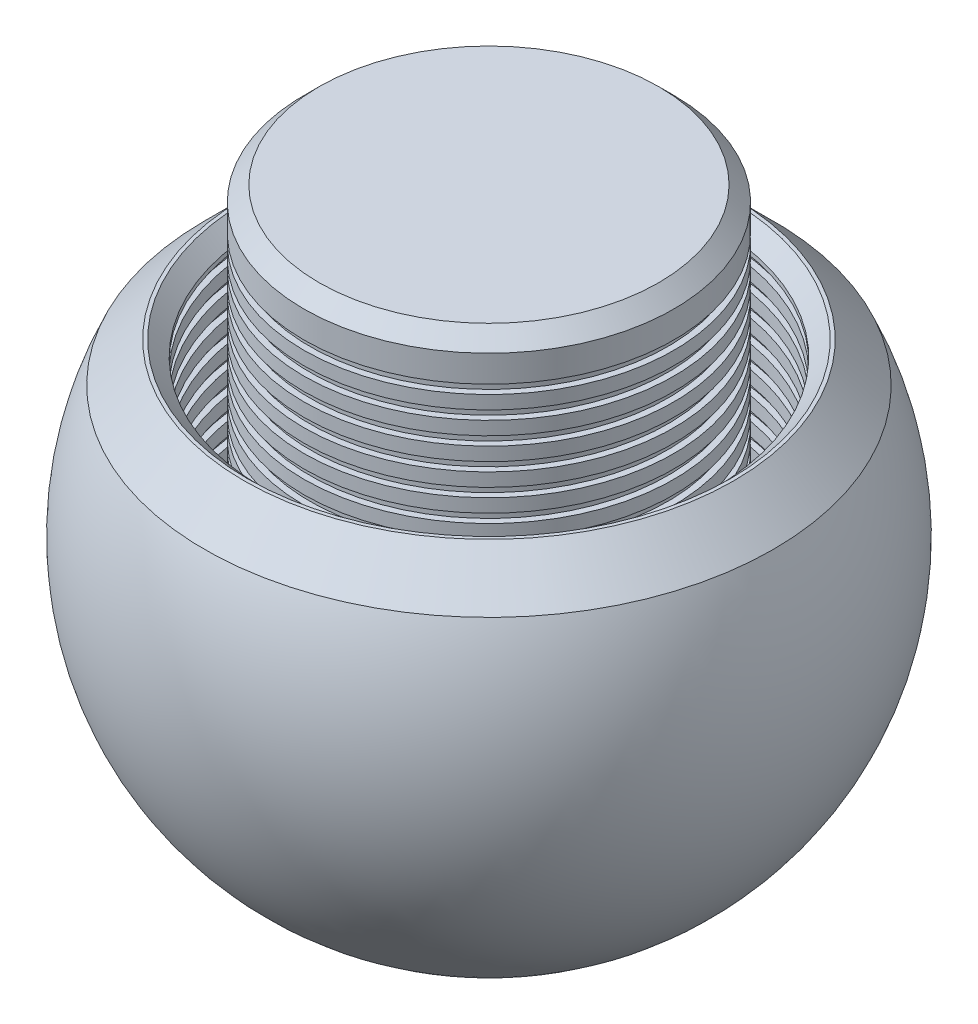
from build123d import *

# Parameters (mm, degrees)
CHAMFER1_SIZE          = 1
MOVE_START             = -5
MOVE_FACE1_OUTLINE_R   = 12.65
MOVE_FACE1_OUTLINE_R_2 = 12.5
MOVE_FACE1_OUTLINE_R_3 = 10.5
MOVE_FACE1_OUTLINE_R_4 = 10.35
MOVE_FACE1_DEPTH       = 22
SKETCH2_W              = 3
SKETCH2_H              = 0.5
LPATTERN1_COUNT        = 15
LPATTERN1_PITCH        = 1.25


with BuildPart() as part:
    # Sketch1 → Revolve1 (revolve)
    with BuildSketch(Plane.XY, mode=Mode.PRIVATE) as revolve1_sk:
        with BuildLine():
            Line((0, -15), (0, 17))
            Line((0, 17), (10.5, 17))
            Line((10.5, 17), (10.5, -5))
            Line((10.5, -5), (12.5, -5))
            Line((12.5, -5), (12.5, 9.5))
            Line((12.5, 9.5), (14.696938457, 9.5))
            ThreePointArc((14.696938457, 9.5), (17.047381221, -3.954338567), (9.013878189, -15))
            Line((9.013878189, -15), (0, -15))
        make_face()
    revolve(revolve1_sk.sketch.rotate(Axis((0, -15, 0), (0, 1, 0)), 90), axis=Axis((0, -15, 0), (0, 1, 0)))

    # Chamfer1
    # the kernel refuses this chamfer: 3.367367181, 1 mm, written as the material it takes off along each edge
    with BuildSketch(Plane(origin=(0, 17, 0), x_dir=(0, 0, -1), z_dir=(1, 0, 0))) as chamfer1_piece_1:
        Polygon((10.5 - CHAMFER1_SIZE, 0), (10.5, -CHAMFER1_SIZE), (10.5, 0), align=None)
    revolve(axis=Axis((0, 17, 0), (0, 1, 0)), mode=Mode.SUBTRACT)
    with BuildSketch(Plane(origin=(0, 9.5, 0), x_dir=(0, 0, -1), z_dir=(1, 0, 0))) as chamfer1_piece_2:
        Polygon((12.5, -CHAMFER1_SIZE), (12.5 + CHAMFER1_SIZE, 0), (12.5, 0), align=None)
    revolve(axis=Axis((0, 9.5, 0), (0, 1, 0)), mode=Mode.SUBTRACT)
    with BuildSketch(Plane(origin=(0, 9.5, 0), x_dir=(0, 0, -1), z_dir=(1, 0, 0))) as chamfer1_piece_3:
        with BuildLine():
            Line((14.696938457 - CHAMFER1_SIZE, 0), (15.911300266, -2.214361809))
            ThreePointArc((15.911300266, -2.214361809), (15.375147387, -1.142079038), (14.696938457, 0))
            Line((14.696938457, 0), (14.696938457 - CHAMFER1_SIZE, 0))
        make_face()
    revolve(axis=Axis((0, 9.5, 0), (0, 1, 0)), mode=Mode.SUBTRACT)

    # Move Face1: read off the stored shape, not the designer's step
    # Move Face1 outline → Move Face1 (cut)
    # profile 1 of 2: a face of its own
    with BuildSketch(Plane(origin=(0, 0, 0), x_dir=(1, 0, 0), z_dir=(0, 1, 0)).offset(MOVE_START)):
        Circle(MOVE_FACE1_OUTLINE_R)
        Circle(MOVE_FACE1_OUTLINE_R_2, mode=Mode.SUBTRACT)
    # profile 2 of 2: a face of its own
    with BuildSketch(Plane(origin=(0, 0, 0), x_dir=(1, 0, 0), z_dir=(0, 1, 0)).offset(MOVE_START)):
        Circle(MOVE_FACE1_OUTLINE_R_3)
        Circle(MOVE_FACE1_OUTLINE_R_4, mode=Mode.SUBTRACT)
    extrude(amount=MOVE_FACE1_DEPTH, mode=Mode.SUBTRACT)

    # Sketch2 → Cut-Revolve1 (revolve, cut)
    with BuildSketch(Plane.XY):
        with Locations((11.5, 14.4)):
            Rectangle(SKETCH2_W, SKETCH2_H)
    cut_revolve1 = revolve(axis=Axis((0, 0, 0), (0, 1, 0)), mode=Mode.SUBTRACT)

    # LPattern1: Cut-Revolve1 ×15
    with Locations(*[(0, -i * LPATTERN1_PITCH, 0) for i in range(1, LPATTERN1_COUNT)]):
        add(cut_revolve1, mode=Mode.SUBTRACT)


solid = part.part
